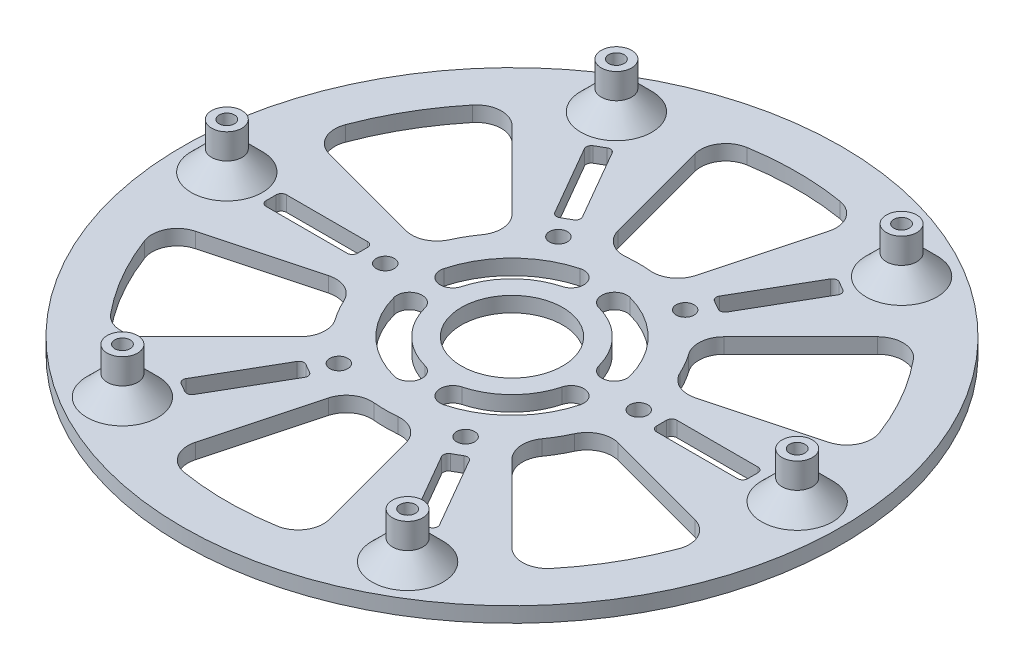
from build123d import *

# Parameters (mm, degrees)
SKETCH_1_R                       = 65
EXTRUDE_1_DEPTH                  = 3
SKETCH_3_R                       = 3
SKETCH_3_R_2                     = 1.525
EXTRUDE_2_DEPTH                  = 9
SKETCH_4_R                       = 1.775
CUT_EXTRUDE_1_DEPTH              = 9
SKETCH_5_W                       = 15
SKETCH_5_H                       = 7
CUT_EXTRUDE_2_DEPTH              = 9
CHAMFER_1_SIZE                   = 4
SKETCH_6_R                       = 1.3
CUT_EXTRUDE_3_DEPTH              = 93.36341267
PATTERN_CIRCULAR_1_COUNT         = 6
CUT_EXTRUDE_4_DEPTH              = 93.36341267
CUT_EXTRUDE_4_DEPTH_BACK         = 93.36341267
SKETCH_7_R                       = 10
SKETCH_8_W                       = 18
SKETCH_8_H                       = 4
CUT_EXTRUDE_5_DEPTH              = 93.36341267
FILLET_1_R                       = 1
PATTERN_CIRCULAR_2_DEPTH         = 3
CUT_EXTRUDE_6_DEPTH              = 93.36341267
FILLET_2_R                       = 5
PATTERN_CIRCULAR_3_COUNT         = 6
FILLET_2_OF_PATTERN_CIRCULAR_3_R = 5
CUT_EXTRUDE_7_DEPTH              = 93.36341267
CUT_EXTRUDE_7_DEPTH_BACK         = 93.36341267
SKETCH_11_R                      = 1.775


# Read off the part's stored shape, not the designer's step: 阵列(圆周)2
with BuildPart() as part:
    # 草图1 → 凸台-拉伸1 (new body)
    with BuildSketch(Plane(origin=(0, 0, 0), x_dir=(1, 0, 0), z_dir=(0, 1, 0))):
        with Locations(Location((0, 0, 0), (0, 0, 270))):
            Circle(SKETCH_1_R)
    extrude(amount=EXTRUDE_1_DEPTH)

    # 草图3 → 凸台-拉伸2 (add)
    # profile 1 of 6: a face of its own
    with BuildSketch(Plane(origin=(0, 3, 0), x_dir=(1, 0, 0), z_dir=(0, 1, 0))):
        with Locations(Location((56.25, 0, 0), (0, 0, 270))):
            Circle(SKETCH_3_R)
        with Locations(Location((56.25, 0, 0), (0, 0, 270))):
            Circle(SKETCH_3_R_2, mode=Mode.SUBTRACT)
    # profile 2 of 6: a face of its own
    with BuildSketch(Plane(origin=(0, 3, 0), x_dir=(1, 0, 0), z_dir=(0, 1, 0))):
        with Locations(Location((28.125, -48.713928963, 0), (0, 0, 270))):
            Circle(SKETCH_3_R)
        with Locations(Location((28.125, -48.713928963, 0), (0, 0, 270))):
            Circle(SKETCH_3_R_2, mode=Mode.SUBTRACT)
    # profile 3 of 6: a face of its own
    with BuildSketch(Plane(origin=(0, 3, 0), x_dir=(1, 0, 0), z_dir=(0, 1, 0))):
        with Locations(Location((-28.125, -48.713928963, 0), (0, 0, 270))):
            Circle(SKETCH_3_R)
        with Locations(Location((-28.125, -48.713928963, 0), (0, 0, 270))):
            Circle(SKETCH_3_R_2, mode=Mode.SUBTRACT)
    # profile 4 of 6: a face of its own
    with BuildSketch(Plane(origin=(0, 3, 0), x_dir=(1, 0, 0), z_dir=(0, 1, 0))):
        with Locations(Location((-56.25, 0, 0), (0, 0, 270))):
            Circle(SKETCH_3_R)
        with Locations(Location((-56.25, 0, 0), (0, 0, 270))):
            Circle(SKETCH_3_R_2, mode=Mode.SUBTRACT)
    # profile 5 of 6: a face of its own
    with BuildSketch(Plane(origin=(0, 3, 0), x_dir=(1, 0, 0), z_dir=(0, 1, 0))):
        with Locations(Location((-28.125, 48.713928963, 0), (0, 0, 270))):
            Circle(SKETCH_3_R)
        with Locations(Location((-28.125, 48.713928963, 0), (0, 0, 270))):
            Circle(SKETCH_3_R_2, mode=Mode.SUBTRACT)
    # profile 6 of 6: a face of its own
    with BuildSketch(Plane(origin=(0, 3, 0), x_dir=(1, 0, 0), z_dir=(0, 1, 0))):
        with Locations(Location((28.125, 48.713928963, 0), (0, 0, 270))):
            Circle(SKETCH_3_R)
        with Locations(Location((28.125, 48.713928963, 0), (0, 0, 270))):
            Circle(SKETCH_3_R_2, mode=Mode.SUBTRACT)
    extrude(amount=EXTRUDE_2_DEPTH)

    # 草图4 → 切除-拉伸1 (cut)
    with BuildSketch(Plane(origin=(0, 3, 0), x_dir=(1, 0, 0), z_dir=(0, 1, 0))):
        with Locations(Location((25, 0, 0), (0, 0, 270))):
            Circle(SKETCH_4_R)
        with Locations(Location((-25, 0, 0), (0, 0, 270))):
            Circle(SKETCH_4_R)
    extrude(amount=-CUT_EXTRUDE_1_DEPTH, mode=Mode.SUBTRACT)

    # 草图5 → 切除-拉伸2 (cut)
    with BuildSketch(Plane.XZ):
        with Locations((0, -40)):
            Rectangle(SKETCH_5_W, SKETCH_5_H)
    extrude(amount=-CUT_EXTRUDE_2_DEPTH, mode=Mode.SUBTRACT)

    # 倒角1
    chamfer_1_edges = [part.edges().sort_by_distance(p)[0] for p in [
        (28.125, 3, 45.713928963),
        (-28.125, 3, 45.713928963),
        (-56.25, 3, -3),
        (-28.125, 3, -51.713928963),
        (28.125, 3, -51.713928963),
        (56.25, 3, -3),
    ]]
    chamfer(chamfer_1_edges, length=CHAMFER_1_SIZE)

    # 草图6 → 切除-拉伸3 (cut, symmetric)
    with BuildSketch(Plane(origin=(0, 3, 0), x_dir=(1, 0, 0), z_dir=(0, 1, 0))):
        with Locations(Location((-56.25, 0, 0), (0, 0, 270))):
            Circle(SKETCH_6_R)
    cut_extrude_3 = extrude(amount=CUT_EXTRUDE_3_DEPTH, both=True, mode=Mode.SUBTRACT)

    # 阵列(圆周)1: 切除-拉伸3 ×6 about axis
    pattern_circular_1_axis = Axis((0, 0, 0), (0, 1, 0))
    for i in range(1, PATTERN_CIRCULAR_1_COUNT):
        add(cut_extrude_3.rotate(pattern_circular_1_axis, i * 360 / PATTERN_CIRCULAR_1_COUNT), mode=Mode.SUBTRACT)

    # 草图7 → 切除-拉伸4 (cut, two sides: drawn at the far end of the back side and taken through both)
    with BuildSketch(Plane(origin=(0, 3, 0), x_dir=(1, 0, 0), z_dir=(0, 1, 0)).offset(-CUT_EXTRUDE_4_DEPTH_BACK)):
        with Locations(Location((0, 0, 0), (0, 0, 270))):
            Circle(SKETCH_7_R)
        with BuildLine():
            ThreePointArc((-4.917561857, 18.352590699), (-13.435028843, 13.435028843), (-18.352590699, 4.917561857))
            ThreePointArc((-18.352590699, 4.917561857), (-16.584823747, 1.855699678), (-13.522961568, 3.623466631))
            ThreePointArc((-13.522961568, 3.623466631), (-9.899494937, 9.899494937), (-3.623466631, 13.522961568))
            ThreePointArc((-3.623466631, 13.522961568), (-1.855699678, 16.584823747), (-4.917561857, 18.352590699))
        make_face()
        with BuildLine():
            ThreePointArc((18.352590699, 4.917561857), (13.435028843, 13.435028843), (4.917561857, 18.352590699))
            ThreePointArc((4.917561857, 18.352590699), (1.855699678, 16.584823747), (3.623466631, 13.522961568))
            ThreePointArc((3.623466631, 13.522961568), (9.899494937, 9.899494937), (13.522961568, 3.623466631))
            ThreePointArc((13.522961568, 3.623466631), (16.584823747, 1.855699678), (18.352590699, 4.917561857))
        make_face()
        with BuildLine():
            ThreePointArc((4.917561857, -18.352590699), (13.435028843, -13.435028843), (18.352590699, -4.917561857))
            ThreePointArc((18.352590699, -4.917561857), (16.584823747, -1.855699678), (13.522961568, -3.623466631))
            ThreePointArc((13.522961568, -3.623466631), (9.899494937, -9.899494937), (3.623466631, -13.522961568))
            ThreePointArc((3.623466631, -13.522961568), (1.855699678, -16.584823747), (4.917561857, -18.352590699))
        make_face()
        with BuildLine():
            ThreePointArc((-18.352590699, -4.917561857), (-13.435028843, -13.435028843), (-4.917561857, -18.352590699))
            ThreePointArc((-4.917561857, -18.352590699), (-1.855699678, -16.584823747), (-3.623466631, -13.522961568))
            ThreePointArc((-3.623466631, -13.522961568), (-9.899494937, -9.899494937), (-13.522961568, -3.623466631))
            ThreePointArc((-13.522961568, -3.623466631), (-16.584823747, -1.855699678), (-18.352590699, -4.917561857))
        make_face()
    extrude(amount=CUT_EXTRUDE_4_DEPTH + CUT_EXTRUDE_4_DEPTH_BACK, mode=Mode.SUBTRACT)

    # 草图8 → 切除-拉伸5 (cut, symmetric)
    with BuildSketch(Plane(origin=(0, 3, 0), x_dir=(1, 0, 0), z_dir=(0, 1, 0))):
        with Locations((-38.5, 0)):
            Rectangle(SKETCH_8_W, SKETCH_8_H)
    extrude(amount=CUT_EXTRUDE_5_DEPTH, both=True, mode=Mode.SUBTRACT)

    # 圆角1
    fillet_1_edges = [part.edges().sort_by_distance(p)[0] for p in [
        (-47.5, 1.5, 2),
        (-47.5, 1.5, -2),
        (-29.5, 1.5, -2),
        (-29.5, 1.5, 2),
        (7.5, 1.5, -36.5),
        (7.5, 1.5, -43.5),
        (-7.5, 1.5, -43.5),
        (-7.5, 1.5, -36.5),
    ]]
    fillet(fillet_1_edges, radius=FILLET_1_R)

    # 阵列(圆周)2 outline → 阵列(圆周)2 (cut)
    with BuildSketch(Plane(origin=(0, 0, 0), x_dir=(1, 0, 0), z_dir=(0, 1, 0))):
        with BuildLine():
            ThreePointArc((47.5, 1), (47.207106781, 1.707106781), (46.5, 2))
            Line((46.5, 2), (30.5, 2))
            ThreePointArc((30.5, 2), (29.792893219, 1.707106781), (29.5, 1))
            Line((29.5, 1), (29.5, -1))
            ThreePointArc((29.5, -1), (29.792893219, -1.707106781), (30.5, -2))
            Line((30.5, -2), (46.5, -2))
            ThreePointArc((46.5, -2), (47.207106781, -1.707106781), (47.5, -1))
            Line((47.5, -1), (47.5, 1))
        make_face()
        with BuildLine():
            ThreePointArc((-24.982050808, -39.270181276), (-25.08195123, -40.029000321), (-24.616025404, -40.63620668))
            Line((-24.616025404, -40.63620668), (-22.883974596, -41.63620668))
            ThreePointArc((-22.883974596, -41.63620668), (-22.125155551, -41.736107102), (-21.517949192, -41.270181276))
            Line((-21.517949192, -41.270181276), (-13.517949192, -27.413774815))
            ThreePointArc((-13.517949192, -27.413774815), (-13.41804877, -26.65495577), (-13.883974596, -26.047749412))
            Line((-13.883974596, -26.047749412), (-15.616025404, -25.047749412))
            ThreePointArc((-15.616025404, -25.047749412), (-16.374844449, -24.947848989), (-16.982050808, -25.413774815))
            Line((-16.982050808, -25.413774815), (-24.982050808, -39.270181276))
        make_face()
        with BuildLine():
            ThreePointArc((22.883974596, 41.63620668), (22.125155551, 41.736107102), (21.517949192, 41.270181276))
            Line((21.517949192, 41.270181276), (13.517949192, 27.413774815))
            ThreePointArc((13.517949192, 27.413774815), (13.41804877, 26.65495577), (13.883974596, 26.047749412))
            Line((13.883974596, 26.047749412), (15.616025404, 25.047749412))
            ThreePointArc((15.616025404, 25.047749412), (16.374844449, 24.947848989), (16.982050808, 25.413774815))
            Line((16.982050808, 25.413774815), (24.982050808, 39.270181276))
            ThreePointArc((24.982050808, 39.270181276), (25.08195123, 40.029000321), (24.616025404, 40.63620668))
            Line((24.616025404, 40.63620668), (22.883974596, 41.63620668))
        make_face()
        with BuildLine():
            ThreePointArc((21.517949192, -41.270181276), (22.125155551, -41.736107102), (22.883974596, -41.63620668))
            Line((22.883974596, -41.63620668), (24.616025404, -40.63620668))
            ThreePointArc((24.616025404, -40.63620668), (25.08195123, -40.029000321), (24.982050808, -39.270181276))
            Line((24.982050808, -39.270181276), (16.982050808, -25.413774815))
            ThreePointArc((16.982050808, -25.413774815), (16.374844449, -24.947848989), (15.616025404, -25.047749412))
            Line((15.616025404, -25.047749412), (13.883974596, -26.047749412))
            ThreePointArc((13.883974596, -26.047749412), (13.41804877, -26.65495577), (13.517949192, -27.413774815))
            Line((13.517949192, -27.413774815), (21.517949192, -41.270181276))
        make_face()
        with BuildLine():
            ThreePointArc((-24.616025404, 40.63620668), (-25.08195123, 40.029000321), (-24.982050808, 39.270181276))
            Line((-24.982050808, 39.270181276), (-16.982050808, 25.413774815))
            ThreePointArc((-16.982050808, 25.413774815), (-16.374844449, 24.947848989), (-15.616025404, 25.047749412))
            Line((-15.616025404, 25.047749412), (-13.883974596, 26.047749412))
            ThreePointArc((-13.883974596, 26.047749412), (-13.41804877, 26.65495577), (-13.517949192, 27.413774815))
            Line((-13.517949192, 27.413774815), (-21.517949192, 41.270181276))
            ThreePointArc((-21.517949192, 41.270181276), (-22.125155551, 41.736107102), (-22.883974596, 41.63620668))
            Line((-22.883974596, 41.63620668), (-24.616025404, 40.63620668))
        make_face()
    extrude(amount=PATTERN_CIRCULAR_2_DEPTH, mode=Mode.SUBTRACT)

    # 草图9 → 切除-拉伸6 (cut, symmetric)
    with BuildSketch(Plane(origin=(0, 3, 0), x_dir=(1, 0, 0), z_dir=(0, 1, 0))):
        with BuildLine():
            Line((6.470476128, -24.148145657), (14.558571287, -54.333327729))
            ThreePointArc((14.558571287, -54.333327729), (0, -56.25), (-14.558571287, -54.333327729))
            Line((-14.558571287, -54.333327729), (-6.470476128, -24.148145657))
            ThreePointArc((-6.470476128, -24.148145657), (0, -25), (6.470476128, -24.148145657))
        make_face()
    cut_extrude_6 = extrude(amount=CUT_EXTRUDE_6_DEPTH, both=True, mode=Mode.SUBTRACT)

    # 圆角2
    fillet_2_edges = [part.edges().sort_by_distance(p)[0] for p in [
        (-6.470476128, 1.5, 24.148145657),
        (6.470476128, 1.5, 24.148145657),
        (14.558571287, 1.5, 54.333327729),
        (-14.558571287, 1.5, 54.333327729),
    ]]
    fillet(fillet_2_edges, radius=FILLET_2_R)

    # 阵列(圆周)3: 切除-拉伸6 ×6 about axis
    pattern_circular_3_axis = Axis((0, 0, 0), (0, 1, 0))
    for i in range(1, PATTERN_CIRCULAR_3_COUNT):
        add(cut_extrude_6.rotate(pattern_circular_3_axis, i * 360 / PATTERN_CIRCULAR_3_COUNT), mode=Mode.SUBTRACT)

    # 圆角2 of 阵列(圆周)3
    fillet_2_of_pattern_circular_3_edges = [part.edges().sort_by_distance(p)[0] for p in [
        (17.67766953, 1.5, 17.67766953),
        (24.148145657, 1.5, 6.470476128),
        (54.333327729, 1.5, 14.558571287),
        (39.774756442, 1.5, 39.774756442),
        (24.148145657, 1.5, -6.470476128),
        (17.67766953, 1.5, -17.67766953),
        (39.774756442, 1.5, -39.774756442),
        (54.333327729, 1.5, -14.558571287),
        (6.470476128, 1.5, -24.148145657),
        (-6.470476128, 1.5, -24.148145657),
        (-14.558571287, 1.5, -54.333327729),
        (14.558571287, 1.5, -54.333327729),
        (-17.67766953, 1.5, -17.67766953),
        (-24.148145657, 1.5, -6.470476128),
        (-54.333327729, 1.5, -14.558571287),
        (-39.774756442, 1.5, -39.774756442),
        (-24.148145657, 1.5, 6.470476128),
        (-17.67766953, 1.5, 17.67766953),
        (-39.774756442, 1.5, 39.774756442),
        (-54.333327729, 1.5, 14.558571287),
    ]]
    fillet(fillet_2_of_pattern_circular_3_edges, radius=FILLET_2_OF_PATTERN_CIRCULAR_3_R)

    # 草图11 → 切除-拉伸7 (cut, two sides: drawn at the far end of the back side and taken through both)
    with BuildSketch(Plane(origin=(0, 3, 0), x_dir=(1, 0, 0), z_dir=(0, 1, 0)).offset(-CUT_EXTRUDE_7_DEPTH_BACK)):
        with Locations(Location((-25, 0, 0), (0, 0, 270))):
            Circle(SKETCH_11_R)
        with Locations(Location((-12.5, 21.650635095, 0), (0, 0, 270))):
            Circle(SKETCH_11_R)
        with Locations(Location((12.5, 21.650635095, 0), (0, 0, 270))):
            Circle(SKETCH_11_R)
        with Locations(Location((25, 0, 0), (0, 0, 270))):
            Circle(SKETCH_11_R)
        with Locations(Location((12.5, -21.650635095, 0), (0, 0, 270))):
            Circle(SKETCH_11_R)
        with Locations(Location((-12.5, -21.650635095, 0), (0, 0, 270))):
            Circle(SKETCH_11_R)
    extrude(amount=CUT_EXTRUDE_7_DEPTH + CUT_EXTRUDE_7_DEPTH_BACK, mode=Mode.SUBTRACT)


solid = part.part
